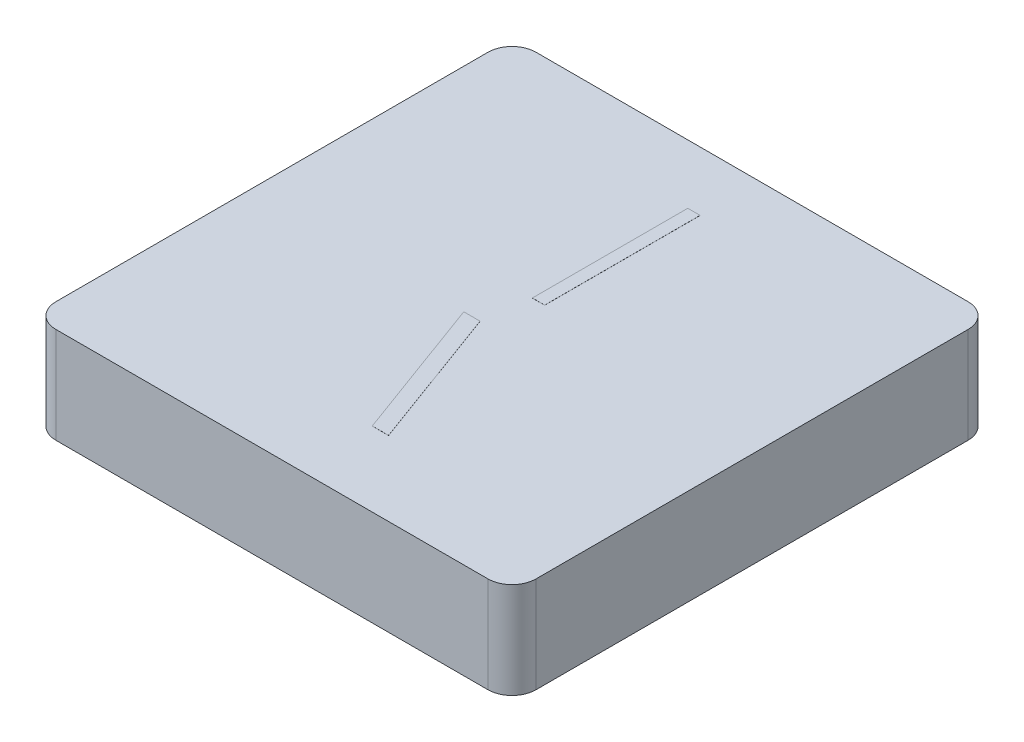
from build123d import *

# Parameters (mm, degrees)
SKETCH1_W           = 12.7
SKETCH1_H           = 12.7
BOSS_EXTRUDE1_DEPTH = 2.54
FILLET1_R           = 0.635
SHELL1_START        = 0.635
SHELL1_OUTLINE_W    = 1.905
SHELL1_OUTLINE_H    = 11.43
SHELL1_DEPTH        = 11.43
SKETCH2_R           = 2.54
BOSS_EXTRUDE2_DEPTH = 1.905
SKETCH4_W           = 0.325641025
SKETCH4_H           = 4.111217948
BOSS_EXTRUDE4_DEPTH = 0.00254


# Read off the part's stored shape, not the designer's step: Shell1
with BuildPart() as part:
    # Sketch1 → Boss-Extrude1 (new body)
    with BuildSketch(Plane(origin=(0, 0, 0), x_dir=(1, 0, 0), z_dir=(0, 1, 0))):
        with Locations((6.35, 6.35)):
            Rectangle(SKETCH1_W, SKETCH1_H)
    extrude(amount=BOSS_EXTRUDE1_DEPTH)

    # Fillet1
    fillet1_edges = [part.edges().sort_by_distance(p)[0] for p in [
        (0, 1.27, -12.7),
        (12.7, 1.27, -12.7),
        (12.7, 1.27, 0),
        (0, 1.27, 0),
    ]]
    fillet(fillet1_edges, radius=FILLET1_R)

    # Shell1 outline → Shell1 (cut)
    with BuildSketch(Plane.YZ.offset(SHELL1_START)):
        with Locations((0.9525, -6.35)):
            Rectangle(SHELL1_OUTLINE_W, SHELL1_OUTLINE_H)
    extrude(amount=SHELL1_DEPTH, mode=Mode.SUBTRACT)

    # Sketch2 → Boss-Extrude2 (add)
    with BuildSketch(Plane(origin=(0, 1.905, 0), x_dir=(-1, 0, 0), z_dir=(0, -1, 0))):
        with Locations(Location((-6.35, 6.35, 0), (0, 0, 270))):
            Circle(SKETCH2_R)
    extrude(amount=BOSS_EXTRUDE2_DEPTH)

    # Sketch4 → Boss-Extrude4 (add)
    with BuildSketch(Plane(origin=(0, 2.54, 0), x_dir=(1, 0, 0), z_dir=(0, 1, 0))):
        Polygon((7.464964343, 1.970128205), (7.033744391, 1.970128205), (5.628145433, 5.796410256), (6.059365385, 5.796410256), align=None)
        with Locations((6.382564102, 9.074801282)):
            Rectangle(SKETCH4_W, SKETCH4_H)
    extrude(amount=BOSS_EXTRUDE4_DEPTH)


solid = part.part
